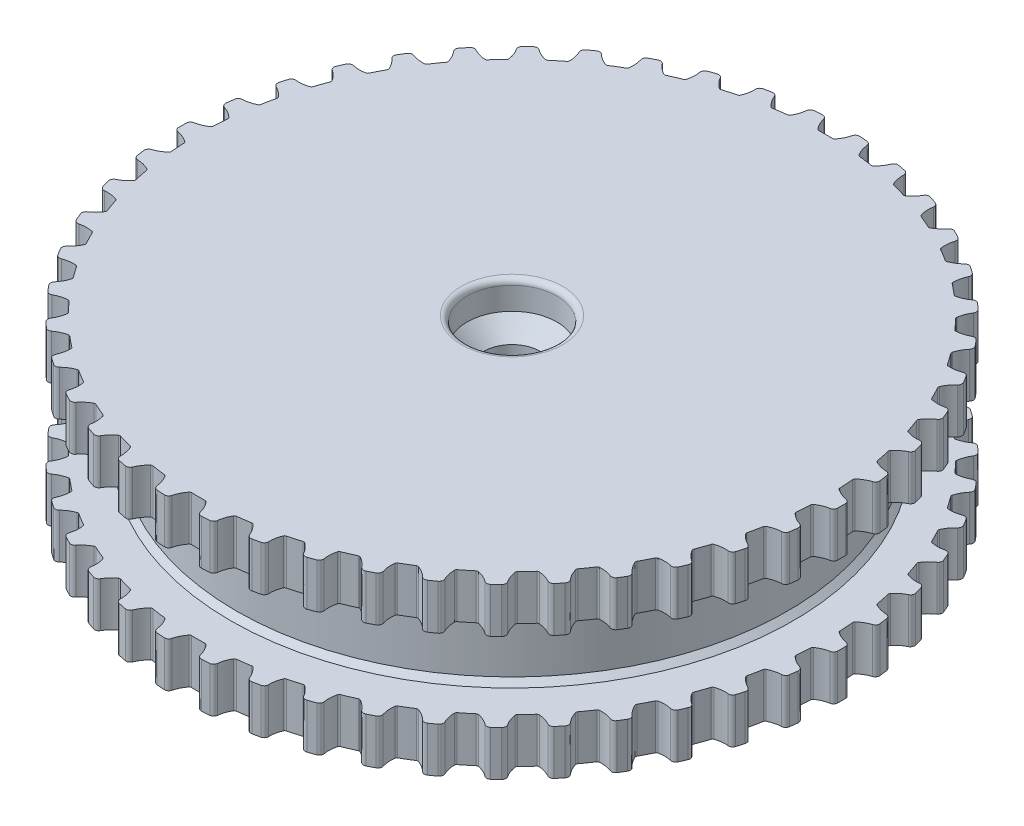
from build123d import *

# Parameters (mm, degrees)
SKETCH1_R           = 62.5
BOSS_EXTRUDE1_DEPTH = 2
BOSS_EXTRUDE2_DEPTH = 30
FILLET2_R           = 0.75
SKETCH3_R           = 62.5
BOSS_EXTRUDE3_DEPTH = 2
SKETCH4_R           = 5
CUT_EXTRUDE1_DEPTH  = 95.702164838
SKETCH5_R           = 8
CUT_EXTRUDE2_DEPTH  = 10
CUT_EXTRUDE3_START  = -10
SKETCH6_R           = 8
CUT_EXTRUDE3_DEPTH  = 10
FILLET3_R           = 0.75
CUT_EXTRUDE4_START  = -2
SKETCH7_R           = 62.5
CUT_EXTRUDE4_DEPTH  = 2
SKETCH9_R           = 62.5
CUT_EXTRUDE5_DEPTH  = 2
CHAMFER1_SIZE       = 3
SKETCH10_W          = 9.6
SKETCH10_H          = 14
CHAMFER2_SIZE       = 1
FILLET4_R           = 1


with BuildPart() as part:
    # Sketch1 → Boss-Extrude1 (new body)
    with BuildSketch(Plane(origin=(0, 0, 0), x_dir=(1, 0, 0), z_dir=(0, 1, 0))):
        with Locations(Location((0, 0, 0), (0, 0, 270))):
            Circle(SKETCH1_R)
    extrude(amount=BOSS_EXTRUDE1_DEPTH)

    # Sketch2 → Boss-Extrude2 (add)
    with BuildSketch(Plane(origin=(0, 2, 0), x_dir=(1, 0, 0), z_dir=(0, 1, 0))):
        with BuildLine():
            ThreePointArc((-1.528949245, 55.875032883), (-2.273279191, 57.114407356), (-2.655005911, 58.508810764))
            ThreePointArc((-2.655005911, 58.508810764), (-3.996891209, 58.432481156), (-5.336671662, 58.325379801))
            ThreePointArc((-5.336671662, 58.325379801), (-5.524971719, 56.891985494), (-6.093607466, 55.562801707))
            ThreePointArc((-6.093607466, 55.562801707), (-6.21983896, 55.432561322), (-6.390611604, 55.371457709))
            ThreePointArc((-6.390611604, 55.371457709), (-7.589795449, 55.219862826), (-8.785410114, 55.04230023))
            ThreePointArc((-8.785410114, 55.04230023), (-8.966335603, 55.055064048), (-9.123024525, 55.146417916))
            ThreePointArc((-9.123024525, 55.146417916), (-10.029183211, 56.272895874), (-10.597225747, 57.602333285))
            ThreePointArc((-10.597225747, 57.602333285), (-11.916219106, 57.343994591), (-13.228937139, 57.055457369))
            ThreePointArc((-13.228937139, 57.055457369), (-13.220302859, 55.609773585), (-13.6026518, 54.215540664))
            ThreePointArc((-13.6026518, 54.215540664), (-13.70997317, 54.069324826), (-13.870834955, 53.985536796))
            ThreePointArc((-13.870834955, 53.985536796), (-15.038207369, 53.672065031), (-16.198507911, 53.33335342))
            ThreePointArc((-16.198507911, 53.33335342), (-16.379486256, 53.321362337), (-16.54715512, 53.390529524))
            ThreePointArc((-16.54715512, 53.390529524), (-17.598262523, 54.383126814), (-18.342039318, 55.622833325))
            ThreePointArc((-18.342039318, 55.622833325), (-19.613570387, 55.187297905), (-20.874772547, 54.722699719))
            ThreePointArc((-20.874772547, 54.722699719), (-20.669364771, 53.291656813), (-20.858304469, 51.858346678))
            ThreePointArc((-20.858304469, 51.858346678), (-20.944716521, 51.698879111), (-21.092670895, 51.593967477))
            ThreePointArc((-21.092670895, 51.593967477), (-22.20648594, 51.124458215), (-23.309858154, 50.630907145))
            ThreePointArc((-23.309858154, 50.630907145), (-23.487518072, 50.594384533), (-23.663043523, 50.640076586))
            ThreePointArc((-23.663043523, 50.640076586), (-24.839519502, 51.480302998), (-25.745175401, 52.607185222))
            ThreePointArc((-25.745175401, 52.607185222), (-26.945557963, 52.002566278), (-28.131750439, 51.370561712))
            ThreePointArc((-28.131750439, 51.370561712), (-27.733395525, 49.980817306), (-27.72540639, 48.535129813))
            ThreePointArc((-27.72540639, 48.535129813), (-27.789299431, 48.365381096), (-27.921590285, 48.241300164))
            ThreePointArc((-27.921590285, 48.241300164), (-28.961099693, 47.624499473), (-29.986989844, 46.985302868))
            ThreePointArc((-29.986989844, 46.985302868), (-30.158021866, 46.924929074), (-30.338134197, 46.946294837))
            ThreePointArc((-30.338134197, 46.946294837), (-31.618063231, 47.618498542), (-32.668727578, 48.611564795))
            ThreePointArc((-32.668727578, 48.611564795), (-33.775600776, 47.849125233), (-34.864687048, 47.061487338))
            ThreePointArc((-34.864687048, 47.061487338), (-34.280805594, 45.738929739), (-34.076036449, 44.307795312))
            ThreePointArc((-34.076036449, 44.307795312), (-34.116220273, 44.130927542), (-34.230383277, 43.989988704))
            ThreePointArc((-34.230383277, 43.989988704), (-35.176222956, 43.237386416), (-36.105520651, 42.464451298))
            ThreePointArc((-36.105520651, 42.464451298), (-36.266738774, 42.381350971), (-36.448082834, 42.37799244))
            ThreePointArc((-36.448082834, 42.37799244), (-37.807622265, 42.869651556), (-38.983723172, 43.710402893))
            ThreePointArc((-38.983723172, 43.710402893), (-39.976468053, 42.80434552), (-40.948160504, 41.875746498))
            ThreePointArc((-40.948160504, 41.875746498), (-40.189629117, 40.645012453), (-39.791894423, 39.255090418))
            ThreePointArc((-39.791894423, 39.255090418), (-39.807620481, 39.074398307), (-39.901528996, 38.919226988))
            ThreePointArc((-39.901528996, 38.919226988), (-40.736079741, 38.044842658), (-41.551473922, 37.152567346))
            ThreePointArc((-41.551473922, 37.152567346), (-41.699874958, 37.048288489), (-41.879072649, 37.020268226))
            ThreePointArc((-41.879072649, 37.020268226), (-43.292896831, 37.322224074), (-44.572525763, 37.994998888))
            ThreePointArc((-44.572525763, 37.994998888), (-45.432649369, 36.962201838), (-46.268847206, 35.909939733))
            ThreePointArc((-46.268847206, 35.909939733), (-45.349795891, 34.793955489), (-44.766504693, 33.471137462))
            ThreePointArc((-44.766504693, 33.471137462), (-44.757480039, 33.289986963), (-44.829384726, 33.12347371))
            ThreePointArc((-44.829384726, 33.12347371), (-45.537100436, 32.143595465), (-46.223401853, 31.14860136))
            ThreePointArc((-46.223401853, 31.14860136), (-46.356221371, 31.02508649), (-46.529934579, 30.97292646))
            ThreePointArc((-46.529934579, 30.97292646), (-47.971706643, 31.079554174), (-49.331026534, 31.571819943))
            ThreePointArc((-49.331026534, 31.571819943), (-50.042506388, 30.431522272), (-50.727632829, 29.275198735))
            ThreePointArc((-50.727632829, 29.275198735), (-49.665181772, 28.294752966), (-48.907199682, 27.063680546))
            ThreePointArc((-48.907199682, 27.063680546), (-48.873592428, 26.88544615), (-48.922153839, 26.710692789))
            ThreePointArc((-48.922153839, 26.710692789), (-49.48985111, 25.643573906), (-50.034275265, 24.564395866))
            ThreePointArc((-50.034275265, 24.564395866), (-50.149039088, 24.423945831), (-50.314031867, 24.348617677))
            ThreePointArc((-50.314031867, 24.348617677), (-51.756894326, 24.257930984), (-53.170583618, 24.560517729))
            ThreePointArc((-53.170583618, 24.560517729), (-53.720166198, 23.333961024), (-54.241458633, 22.095116175))
            ThreePointArc((-54.241458633, 22.095116175), (-53.055399288, 21.268472731), (-52.136846077, 20.152078467))
            ThreePointArc((-52.136846077, 20.152078467), (-52.079282262, 19.980080343), (-52.10359579, 19.8003422))
            ThreePointArc((-52.10359579, 19.8003422), (-52.520699495, 18.665861085), (-52.913104797, 17.522602155))
            ThreePointArc((-52.913104797, 17.522602155), (-53.007675094, 17.367833273), (-53.160873938, 17.270740216))
            ThreePointArc((-53.160873938, 17.270740216), (-54.577948995, 16.984428438), (-56.019673332, 17.09169954))
            ThreePointArc((-56.019673332, 17.09169954), (-56.397120954, 15.801732232), (-56.744868691, 14.503443406))
            ThreePointArc((-56.744868691, 14.503443406), (-55.457295099, 13.846001091), (-54.395281677, 12.865081296))
            ThreePointArc((-54.395281677, 12.865081296), (-54.314833606, 12.702523444), (-54.314446336, 12.5211487))
            ThreePointArc((-54.314446336, 12.5211487), (-54.573186623, 11.340438589), (-54.806263302, 10.154395519))
            ThreePointArc((-54.806263302, 10.154395519), (-54.878878406, 9.988190843), (-55.017429512, 9.871141543))
            ThreePointArc((-55.017429512, 9.871141543), (-56.38231974, 9.394538126), (-57.825222525, 9.304495327))
            ThreePointArc((-57.825222525, 9.304495327), (-58.023504054, 7.975147066), (-58.191229211, 6.641598929))
            ThreePointArc((-58.191229211, 6.641598929), (-56.826126432, 6.165604648), (-55.640436098, 5.338432002))
            ThreePointArc((-55.640436098, 5.338432002), (-55.538602367, 5.188342567), (-55.513521513, 5.00870989))
            ThreePointArc((-55.513521513, 5.00870989), (-55.609078539, 3.803765179), (-55.67848482, 2.597031708))
            ThreePointArc((-55.67848482, 2.597031708), (-55.727792049, 2.422487316), (-55.849114471, 2.287662179))
            ThreePointArc((-55.849114471, 2.287662179), (-57.136394548, 1.629645343), (-58.553597232, 1.343965971))
            ThreePointArc((-58.553597232, 1.343965971), (-58.569019058, 0), (-58.553597232, -1.343965971))
            ThreePointArc((-58.553597232, -1.343965971), (-57.136394548, -1.629645343), (-55.849114471, -2.287662179))
            ThreePointArc((-55.849114471, -2.287662179), (-55.727792049, -2.422487316), (-55.67848482, -2.597031708))
            ThreePointArc((-55.67848482, -2.597031708), (-55.609078539, -3.803765179), (-55.513521513, -5.00870989))
            ThreePointArc((-55.513521513, -5.00870989), (-55.538602367, -5.188342567), (-55.640436098, -5.338432002))
            ThreePointArc((-55.640436098, -5.338432002), (-56.826126432, -6.165604648), (-58.191229211, -6.641598929))
            ThreePointArc((-58.191229211, -6.641598929), (-58.023504054, -7.975147066), (-57.825222525, -9.304495327))
            ThreePointArc((-57.825222525, -9.304495327), (-56.38231974, -9.394538126), (-55.017429512, -9.871141543))
            ThreePointArc((-55.017429512, -9.871141543), (-54.878878406, -9.988190843), (-54.806263302, -10.154395519))
            ThreePointArc((-54.806263302, -10.154395519), (-54.573186623, -11.340438589), (-54.314446336, -12.5211487))
            ThreePointArc((-54.314446336, -12.5211487), (-54.314833606, -12.702523444), (-54.395281677, -12.865081296))
            ThreePointArc((-54.395281677, -12.865081296), (-55.457295099, -13.846001091), (-56.744868691, -14.503443406))
            ThreePointArc((-56.744868691, -14.503443406), (-56.397120954, -15.801732232), (-56.019673332, -17.09169954))
            ThreePointArc((-56.019673332, -17.09169954), (-54.577948995, -16.984428438), (-53.160873938, -17.270740216))
            ThreePointArc((-53.160873938, -17.270740216), (-53.007675094, -17.367833273), (-52.913104797, -17.522602155))
            ThreePointArc((-52.913104797, -17.522602155), (-52.520699495, -18.665861085), (-52.10359579, -19.8003422))
            ThreePointArc((-52.10359579, -19.8003422), (-52.079282262, -19.980080343), (-52.136846077, -20.152078467))
            ThreePointArc((-52.136846077, -20.152078467), (-53.055399288, -21.268472731), (-54.241458633, -22.095116175))
            ThreePointArc((-54.241458633, -22.095116175), (-53.720166198, -23.333961024), (-53.170583618, -24.560517729))
            ThreePointArc((-53.170583618, -24.560517729), (-51.756894326, -24.257930984), (-50.314031867, -24.348617677))
            ThreePointArc((-50.314031867, -24.348617677), (-50.149039088, -24.423945831), (-50.034275265, -24.564395866))
            ThreePointArc((-50.034275265, -24.564395866), (-49.48985111, -25.643573906), (-48.922153839, -26.710692789))
            ThreePointArc((-48.922153839, -26.710692789), (-48.873592428, -26.88544615), (-48.907199682, -27.063680546))
            ThreePointArc((-48.907199682, -27.063680546), (-49.665181772, -28.294752966), (-50.727632829, -29.275198735))
            ThreePointArc((-50.727632829, -29.275198735), (-50.042506388, -30.431522272), (-49.331026534, -31.571819943))
            ThreePointArc((-49.331026534, -31.571819943), (-47.971706643, -31.079554174), (-46.529934579, -30.97292646))
            ThreePointArc((-46.529934579, -30.97292646), (-46.356221371, -31.02508649), (-46.223401853, -31.14860136))
            ThreePointArc((-46.223401853, -31.14860136), (-45.537100436, -32.143595465), (-44.829384726, -33.12347371))
            ThreePointArc((-44.829384726, -33.12347371), (-44.757480039, -33.289986963), (-44.766504693, -33.471137462))
            ThreePointArc((-44.766504693, -33.471137462), (-45.349795891, -34.793955489), (-46.268847206, -35.909939733))
            ThreePointArc((-46.268847206, -35.909939733), (-45.432649369, -36.962201838), (-44.572525763, -37.994998888))
            ThreePointArc((-44.572525763, -37.994998888), (-43.292896831, -37.322224074), (-41.879072649, -37.020268226))
            ThreePointArc((-41.879072649, -37.020268226), (-41.699874958, -37.048288489), (-41.551473922, -37.152567346))
            ThreePointArc((-41.551473922, -37.152567346), (-40.736079741, -38.044842658), (-39.901528996, -38.919226988))
            ThreePointArc((-39.901528996, -38.919226988), (-39.807620481, -39.074398307), (-39.791894423, -39.255090418))
            ThreePointArc((-39.791894423, -39.255090418), (-40.189629117, -40.645012453), (-40.948160504, -41.875746498))
            ThreePointArc((-40.948160504, -41.875746498), (-39.976468053, -42.80434552), (-38.983723172, -43.710402893))
            ThreePointArc((-38.983723172, -43.710402893), (-37.807622265, -42.869651556), (-36.448082834, -42.37799244))
            ThreePointArc((-36.448082834, -42.37799244), (-36.266738774, -42.381350971), (-36.105520651, -42.464451298))
            ThreePointArc((-36.105520651, -42.464451298), (-35.176222956, -43.237386416), (-34.230383277, -43.989988704))
            ThreePointArc((-34.230383277, -43.989988704), (-34.116220273, -44.130927542), (-34.076036449, -44.307795312))
            ThreePointArc((-34.076036449, -44.307795312), (-34.280805594, -45.738929739), (-34.864687048, -47.061487338))
            ThreePointArc((-34.864687048, -47.061487338), (-33.775600776, -47.849125233), (-32.668727578, -48.611564795))
            ThreePointArc((-32.668727578, -48.611564795), (-31.618063231, -47.618498542), (-30.338134197, -46.946294837))
            ThreePointArc((-30.338134197, -46.946294837), (-30.158021866, -46.924929074), (-29.986989844, -46.985302868))
            ThreePointArc((-29.986989844, -46.985302868), (-28.961099693, -47.624499473), (-27.921590285, -48.241300164))
            ThreePointArc((-27.921590285, -48.241300164), (-27.789299431, -48.365381096), (-27.72540639, -48.535129813))
            ThreePointArc((-27.72540639, -48.535129813), (-27.733395525, -49.980817306), (-28.131750439, -51.370561712))
            ThreePointArc((-28.131750439, -51.370561712), (-26.945557963, -52.002566278), (-25.745175401, -52.607185222))
            ThreePointArc((-25.745175401, -52.607185222), (-24.839519502, -51.480302998), (-23.663043523, -50.640076586))
            ThreePointArc((-23.663043523, -50.640076586), (-23.487518072, -50.594384533), (-23.309858154, -50.630907145))
            ThreePointArc((-23.309858154, -50.630907145), (-22.20648594, -51.124458215), (-21.092670895, -51.593967477))
            ThreePointArc((-21.092670895, -51.593967477), (-20.944716521, -51.698879111), (-20.858304469, -51.858346678))
            ThreePointArc((-20.858304469, -51.858346678), (-20.669364771, -53.291656813), (-20.874772547, -54.722699719))
            ThreePointArc((-20.874772547, -54.722699719), (-19.613570387, -55.187297905), (-18.342039318, -55.622833325))
            ThreePointArc((-18.342039318, -55.622833325), (-17.598262523, -54.383126814), (-16.54715512, -53.390529524))
            ThreePointArc((-16.54715512, -53.390529524), (-16.379486256, -53.321362337), (-16.198507911, -53.33335342))
            ThreePointArc((-16.198507911, -53.33335342), (-15.038207369, -53.672065031), (-13.870834955, -53.985536796))
            ThreePointArc((-13.870834955, -53.985536796), (-13.70997317, -54.069324826), (-13.6026518, -54.215540664))
            ThreePointArc((-13.6026518, -54.215540664), (-13.220302859, -55.609773585), (-13.228937139, -57.055457369))
            ThreePointArc((-13.228937139, -57.055457369), (-11.916219106, -57.343994591), (-10.597225747, -57.602333285))
            ThreePointArc((-10.597225747, -57.602333285), (-10.029183211, -56.272895874), (-9.123024525, -55.146417916))
            ThreePointArc((-9.123024525, -55.146417916), (-8.966335603, -55.055064048), (-8.785410114, -55.04230023))
            ThreePointArc((-8.785410114, -55.04230023), (-7.589795449, -55.219862826), (-6.390611604, -55.371457709))
            ThreePointArc((-6.390611604, -55.371457709), (-6.21983896, -55.432561322), (-6.093607466, -55.562801707))
            ThreePointArc((-6.093607466, -55.562801707), (-5.524971719, -56.891985494), (-5.336671662, -58.325379801))
            ThreePointArc((-5.336671662, -58.325379801), (-3.996891209, -58.432481156), (-2.655005911, -58.508810764))
            ThreePointArc((-2.655005911, -58.508810764), (-2.273279191, -57.114407356), (-1.528949245, -55.875032883))
            ThreePointArc((-1.528949245, -55.875032883), (-1.386159082, -55.763194084), (-1.208656749, -55.725913132))
            ThreePointArc((-1.208656749, -55.725913132), (0, -55.739019058), (1.208656749, -55.725913132))
            ThreePointArc((1.208656749, -55.725913132), (1.386159082, -55.763194084), (1.528949245, -55.875032883))
            ThreePointArc((1.528949245, -55.875032883), (2.273279191, -57.114407356), (2.655005911, -58.508810764))
            ThreePointArc((2.655005911, -58.508810764), (3.996891209, -58.432481156), (5.336671662, -58.325379801))
            ThreePointArc((5.336671662, -58.325379801), (5.524971719, -56.891985494), (6.093607466, -55.562801707))
            ThreePointArc((6.093607466, -55.562801707), (6.21983896, -55.432561322), (6.390611604, -55.371457709))
            ThreePointArc((6.390611604, -55.371457709), (7.589795449, -55.219862826), (8.785410114, -55.04230023))
            ThreePointArc((8.785410114, -55.04230023), (8.966335603, -55.055064048), (9.123024525, -55.146417916))
            ThreePointArc((9.123024525, -55.146417916), (10.029183211, -56.272895874), (10.597225747, -57.602333285))
            ThreePointArc((10.597225747, -57.602333285), (11.916219106, -57.343994591), (13.228937139, -57.055457369))
            ThreePointArc((13.228937139, -57.055457369), (13.220302859, -55.609773585), (13.6026518, -54.215540664))
            ThreePointArc((13.6026518, -54.215540664), (13.70997317, -54.069324826), (13.870834955, -53.985536796))
            ThreePointArc((13.870834955, -53.985536796), (15.038207369, -53.672065031), (16.198507911, -53.33335342))
            ThreePointArc((16.198507911, -53.33335342), (16.379486256, -53.321362337), (16.54715512, -53.390529524))
            ThreePointArc((16.54715512, -53.390529524), (17.598262523, -54.383126814), (18.342039318, -55.622833325))
            ThreePointArc((18.342039318, -55.622833325), (19.613570387, -55.187297905), (20.874772547, -54.722699719))
            ThreePointArc((20.874772547, -54.722699719), (20.669364771, -53.291656813), (20.858304469, -51.858346678))
            ThreePointArc((20.858304469, -51.858346678), (20.944716521, -51.698879111), (21.092670895, -51.593967477))
            ThreePointArc((21.092670895, -51.593967477), (22.20648594, -51.124458215), (23.309858154, -50.630907145))
            ThreePointArc((23.309858154, -50.630907145), (23.487518072, -50.594384533), (23.663043523, -50.640076586))
            ThreePointArc((23.663043523, -50.640076586), (24.839519502, -51.480302998), (25.745175401, -52.607185222))
            ThreePointArc((25.745175401, -52.607185222), (26.945557963, -52.002566278), (28.131750439, -51.370561712))
            ThreePointArc((28.131750439, -51.370561712), (27.733395525, -49.980817306), (27.72540639, -48.535129813))
            ThreePointArc((27.72540639, -48.535129813), (27.789299431, -48.365381096), (27.921590285, -48.241300164))
            ThreePointArc((27.921590285, -48.241300164), (28.961099693, -47.624499473), (29.986989844, -46.985302868))
            ThreePointArc((29.986989844, -46.985302868), (30.158021866, -46.924929074), (30.338134197, -46.946294837))
            ThreePointArc((30.338134197, -46.946294837), (31.618063231, -47.618498542), (32.668727578, -48.611564795))
            ThreePointArc((32.668727578, -48.611564795), (33.775600776, -47.849125233), (34.864687048, -47.061487338))
            ThreePointArc((34.864687048, -47.061487338), (34.280805594, -45.738929739), (34.076036449, -44.307795312))
            ThreePointArc((34.076036449, -44.307795312), (34.116220273, -44.130927542), (34.230383277, -43.989988704))
            ThreePointArc((34.230383277, -43.989988704), (35.176222956, -43.237386416), (36.105520651, -42.464451298))
            ThreePointArc((36.105520651, -42.464451298), (36.266738774, -42.381350971), (36.448082834, -42.37799244))
            ThreePointArc((36.448082834, -42.37799244), (37.807622265, -42.869651556), (38.983723172, -43.710402893))
            ThreePointArc((38.983723172, -43.710402893), (39.976468053, -42.80434552), (40.948160504, -41.875746498))
            ThreePointArc((40.948160504, -41.875746498), (40.189629117, -40.645012453), (39.791894423, -39.255090418))
            ThreePointArc((39.791894423, -39.255090418), (39.807620481, -39.074398307), (39.901528996, -38.919226988))
            ThreePointArc((39.901528996, -38.919226988), (40.736079741, -38.044842658), (41.551473922, -37.152567346))
            ThreePointArc((41.551473922, -37.152567346), (41.699874958, -37.048288489), (41.879072649, -37.020268226))
            ThreePointArc((41.879072649, -37.020268226), (43.292896831, -37.322224074), (44.572525763, -37.994998888))
            ThreePointArc((44.572525763, -37.994998888), (45.432649369, -36.962201838), (46.268847206, -35.909939733))
            ThreePointArc((46.268847206, -35.909939733), (45.349795891, -34.793955489), (44.766504693, -33.471137462))
            ThreePointArc((44.766504693, -33.471137462), (44.757480039, -33.289986963), (44.829384726, -33.12347371))
            ThreePointArc((44.829384726, -33.12347371), (45.537100436, -32.143595465), (46.223401853, -31.14860136))
            ThreePointArc((46.223401853, -31.14860136), (46.356221371, -31.02508649), (46.529934579, -30.97292646))
            ThreePointArc((46.529934579, -30.97292646), (47.971706643, -31.079554174), (49.331026534, -31.571819943))
            ThreePointArc((49.331026534, -31.571819943), (50.042506388, -30.431522272), (50.727632829, -29.275198735))
            ThreePointArc((50.727632829, -29.275198735), (49.665181772, -28.294752966), (48.907199682, -27.063680546))
            ThreePointArc((48.907199682, -27.063680546), (48.873592428, -26.88544615), (48.922153839, -26.710692789))
            ThreePointArc((48.922153839, -26.710692789), (49.48985111, -25.643573906), (50.034275265, -24.564395866))
            ThreePointArc((50.034275265, -24.564395866), (50.149039088, -24.423945831), (50.314031867, -24.348617677))
            ThreePointArc((50.314031867, -24.348617677), (51.756894326, -24.257930984), (53.170583618, -24.560517729))
            ThreePointArc((53.170583618, -24.560517729), (53.720166198, -23.333961024), (54.241458633, -22.095116175))
            ThreePointArc((54.241458633, -22.095116175), (53.055399288, -21.268472731), (52.136846077, -20.152078467))
            ThreePointArc((52.136846077, -20.152078467), (52.079282262, -19.980080343), (52.10359579, -19.8003422))
            ThreePointArc((52.10359579, -19.8003422), (52.520699495, -18.665861085), (52.913104797, -17.522602155))
            ThreePointArc((52.913104797, -17.522602155), (53.007675094, -17.367833273), (53.160873938, -17.270740216))
            ThreePointArc((53.160873938, -17.270740216), (54.577948995, -16.984428438), (56.019673332, -17.09169954))
            ThreePointArc((56.019673332, -17.09169954), (56.397120954, -15.801732232), (56.744868691, -14.503443406))
            ThreePointArc((56.744868691, -14.503443406), (55.457295099, -13.846001091), (54.395281677, -12.865081296))
            ThreePointArc((54.395281677, -12.865081296), (54.314833606, -12.702523444), (54.314446336, -12.5211487))
            ThreePointArc((54.314446336, -12.5211487), (54.573186623, -11.340438589), (54.806263302, -10.154395519))
            ThreePointArc((54.806263302, -10.154395519), (54.878878406, -9.988190843), (55.017429512, -9.871141543))
            ThreePointArc((55.017429512, -9.871141543), (56.38231974, -9.394538126), (57.825222525, -9.304495327))
            ThreePointArc((57.825222525, -9.304495327), (58.023504054, -7.975147066), (58.191229211, -6.641598929))
            ThreePointArc((58.191229211, -6.641598929), (56.826126432, -6.165604648), (55.640436098, -5.338432002))
            ThreePointArc((55.640436098, -5.338432002), (55.538602367, -5.188342567), (55.513521513, -5.00870989))
            ThreePointArc((55.513521513, -5.00870989), (55.609078539, -3.803765179), (55.67848482, -2.597031708))
            ThreePointArc((55.67848482, -2.597031708), (55.727792049, -2.422487316), (55.849114471, -2.287662179))
            ThreePointArc((55.849114471, -2.287662179), (57.136394548, -1.629645343), (58.553597232, -1.343965971))
            ThreePointArc((58.553597232, -1.343965971), (58.565163475, -0.672027225), (58.569019058, 0))
            ThreePointArc((58.569019058, 0), (58.565163475, 0.672027225), (58.553597232, 1.343965971))
            ThreePointArc((58.553597232, 1.343965971), (57.136394548, 1.629645343), (55.849114471, 2.287662179))
            ThreePointArc((55.849114471, 2.287662179), (55.727792049, 2.422487316), (55.67848482, 2.597031708))
            ThreePointArc((55.67848482, 2.597031708), (55.609078539, 3.803765179), (55.513521513, 5.00870989))
            ThreePointArc((55.513521513, 5.00870989), (55.538602367, 5.188342567), (55.640436098, 5.338432002))
            ThreePointArc((55.640436098, 5.338432002), (56.826126432, 6.165604648), (58.191229211, 6.641598929))
            ThreePointArc((58.191229211, 6.641598929), (58.023504054, 7.975147066), (57.825222525, 9.304495327))
            ThreePointArc((57.825222525, 9.304495327), (56.38231974, 9.394538126), (55.017429512, 9.871141543))
            ThreePointArc((55.017429512, 9.871141543), (54.878878406, 9.988190843), (54.806263302, 10.154395519))
            ThreePointArc((54.806263302, 10.154395519), (54.573186623, 11.340438589), (54.314446336, 12.5211487))
            ThreePointArc((54.314446336, 12.5211487), (54.314833606, 12.702523444), (54.395281677, 12.865081296))
            ThreePointArc((54.395281677, 12.865081296), (55.457295099, 13.846001091), (56.744868691, 14.503443406))
            ThreePointArc((56.744868691, 14.503443406), (56.397120954, 15.801732232), (56.019673332, 17.09169954))
            ThreePointArc((56.019673332, 17.09169954), (54.577948995, 16.984428438), (53.160873938, 17.270740216))
            ThreePointArc((53.160873938, 17.270740216), (53.007675094, 17.367833273), (52.913104797, 17.522602155))
            ThreePointArc((52.913104797, 17.522602155), (52.520699495, 18.665861085), (52.10359579, 19.8003422))
            ThreePointArc((52.10359579, 19.8003422), (52.079282262, 19.980080343), (52.136846077, 20.152078467))
            ThreePointArc((52.136846077, 20.152078467), (53.055399288, 21.268472731), (54.241458633, 22.095116175))
            ThreePointArc((54.241458633, 22.095116175), (53.720166198, 23.333961024), (53.170583618, 24.560517729))
            ThreePointArc((53.170583618, 24.560517729), (51.756894326, 24.257930984), (50.314031867, 24.348617677))
            ThreePointArc((50.314031867, 24.348617677), (50.149039088, 24.423945831), (50.034275265, 24.564395866))
            ThreePointArc((50.034275265, 24.564395866), (49.48985111, 25.643573906), (48.922153839, 26.710692789))
            ThreePointArc((48.922153839, 26.710692789), (48.873592428, 26.88544615), (48.907199682, 27.063680546))
            ThreePointArc((48.907199682, 27.063680546), (49.665181772, 28.294752966), (50.727632829, 29.275198735))
            ThreePointArc((50.727632829, 29.275198735), (50.042506388, 30.431522272), (49.331026534, 31.571819943))
            ThreePointArc((49.331026534, 31.571819943), (47.971706643, 31.079554174), (46.529934579, 30.97292646))
            ThreePointArc((46.529934579, 30.97292646), (46.356221371, 31.02508649), (46.223401853, 31.14860136))
            ThreePointArc((46.223401853, 31.14860136), (45.537100436, 32.143595465), (44.829384726, 33.12347371))
            ThreePointArc((44.829384726, 33.12347371), (44.757480039, 33.289986963), (44.766504693, 33.471137462))
            ThreePointArc((44.766504693, 33.471137462), (45.349795891, 34.793955489), (46.268847206, 35.909939733))
            ThreePointArc((46.268847206, 35.909939733), (45.432649369, 36.962201838), (44.572525763, 37.994998888))
            ThreePointArc((44.572525763, 37.994998888), (43.292896831, 37.322224074), (41.879072649, 37.020268226))
            ThreePointArc((41.879072649, 37.020268226), (41.699874958, 37.048288489), (41.551473922, 37.152567346))
            ThreePointArc((41.551473922, 37.152567346), (40.736079741, 38.044842658), (39.901528996, 38.919226988))
            ThreePointArc((39.901528996, 38.919226988), (39.807620481, 39.074398307), (39.791894423, 39.255090418))
            ThreePointArc((39.791894423, 39.255090418), (40.189629117, 40.645012453), (40.948160504, 41.875746498))
            ThreePointArc((40.948160504, 41.875746498), (39.976468053, 42.80434552), (38.983723172, 43.710402893))
            ThreePointArc((38.983723172, 43.710402893), (37.807622265, 42.869651556), (36.448082834, 42.37799244))
            ThreePointArc((36.448082834, 42.37799244), (36.266738774, 42.381350971), (36.105520651, 42.464451298))
            ThreePointArc((36.105520651, 42.464451298), (35.176222956, 43.237386416), (34.230383277, 43.989988704))
            ThreePointArc((34.230383277, 43.989988704), (34.116220273, 44.130927542), (34.076036449, 44.307795312))
            ThreePointArc((34.076036449, 44.307795312), (34.280805594, 45.738929739), (34.864687048, 47.061487338))
            ThreePointArc((34.864687048, 47.061487338), (33.775600776, 47.849125233), (32.668727578, 48.611564795))
            ThreePointArc((32.668727578, 48.611564795), (31.618063231, 47.618498542), (30.338134197, 46.946294837))
            ThreePointArc((30.338134197, 46.946294837), (30.158021866, 46.924929074), (29.986989844, 46.985302868))
            ThreePointArc((29.986989844, 46.985302868), (28.961099693, 47.624499473), (27.921590285, 48.241300164))
            ThreePointArc((27.921590285, 48.241300164), (27.789299431, 48.365381096), (27.72540639, 48.535129813))
            ThreePointArc((27.72540639, 48.535129813), (27.733395525, 49.980817306), (28.131750439, 51.370561712))
            ThreePointArc((28.131750439, 51.370561712), (26.945557963, 52.002566278), (25.745175401, 52.607185222))
            ThreePointArc((25.745175401, 52.607185222), (24.839519502, 51.480302998), (23.663043523, 50.640076586))
            ThreePointArc((23.663043523, 50.640076586), (23.487518072, 50.594384533), (23.309858154, 50.630907145))
            ThreePointArc((23.309858154, 50.630907145), (22.20648594, 51.124458215), (21.092670895, 51.593967477))
            ThreePointArc((21.092670895, 51.593967477), (20.944716521, 51.698879111), (20.858304469, 51.858346678))
            ThreePointArc((20.858304469, 51.858346678), (20.669364771, 53.291656813), (20.874772547, 54.722699719))
            ThreePointArc((20.874772547, 54.722699719), (19.613570387, 55.187297905), (18.342039318, 55.622833325))
            ThreePointArc((18.342039318, 55.622833325), (17.598262523, 54.383126814), (16.54715512, 53.390529524))
            ThreePointArc((16.54715512, 53.390529524), (16.379486256, 53.321362337), (16.198507911, 53.33335342))
            ThreePointArc((16.198507911, 53.33335342), (15.038207369, 53.672065031), (13.870834955, 53.985536796))
            ThreePointArc((13.870834955, 53.985536796), (13.70997317, 54.069324826), (13.6026518, 54.215540664))
            ThreePointArc((13.6026518, 54.215540664), (13.220302859, 55.609773585), (13.228937139, 57.055457369))
            ThreePointArc((13.228937139, 57.055457369), (11.916219106, 57.343994591), (10.597225747, 57.602333285))
            ThreePointArc((10.597225747, 57.602333285), (10.029183211, 56.272895874), (9.123024525, 55.146417916))
            ThreePointArc((9.123024525, 55.146417916), (8.966335603, 55.055064048), (8.785410114, 55.04230023))
            ThreePointArc((8.785410114, 55.04230023), (7.589795449, 55.219862826), (6.390611604, 55.371457709))
            ThreePointArc((6.390611604, 55.371457709), (6.21983896, 55.432561322), (6.093607466, 55.562801707))
            ThreePointArc((6.093607466, 55.562801707), (5.524971719, 56.891985494), (5.336671662, 58.325379801))
            ThreePointArc((5.336671662, 58.325379801), (3.996891209, 58.432481156), (2.655005911, 58.508810764))
            ThreePointArc((2.655005911, 58.508810764), (2.273279191, 57.114407356), (1.528949245, 55.875032883))
            ThreePointArc((1.528949245, 55.875032883), (1.386159082, 55.763194084), (1.208656749, 55.725913132))
            ThreePointArc((1.208656749, 55.725913132), (0, 55.739019058), (-1.208656749, 55.725913132))
            ThreePointArc((-1.208656749, 55.725913132), (-1.386159082, 55.763194084), (-1.528949245, 55.875032883))
        make_face()
    extrude(amount=BOSS_EXTRUDE2_DEPTH)

    # Fillet2
    fillet2_edges = [part.edges().sort_by_distance(p)[0] for p in [
        (-18.342039318, 17, -55.622833325),
        (-20.874772547, 17, -54.722699719),
        (-25.745175401, 17, -52.607185222),
        (-28.131750439, 17, -51.370561712),
        (-32.668727578, 17, -48.611564795),
        (-34.864687048, 17, -47.061487338),
        (-38.983723172, 17, -43.710402893),
        (-40.948160504, 17, -41.875746498),
        (-44.572525763, 17, -37.994998888),
        (-46.268847206, 17, -35.909939733),
        (-49.331026534, 17, -31.571819943),
        (-50.727632829, 17, -29.275198735),
        (-53.170583618, 17, -24.560517729),
        (-54.241458633, 17, -22.095116175),
        (-56.019673332, 17, -17.09169954),
        (-56.744868691, 17, -14.503443406),
        (-57.825222525, 17, -9.304495327),
        (-58.191229211, 17, -6.641598929),
        (-58.553597232, 17, -1.343965971),
        (-58.553597232, 17, 1.343965971),
        (-58.191229211, 17, 6.641598929),
        (-57.825222525, 17, 9.304495327),
        (-56.744868691, 17, 14.503443406),
        (-56.019673332, 17, 17.09169954),
        (-54.241458633, 17, 22.095116175),
        (-53.170583618, 17, 24.560517729),
        (-50.727632829, 17, 29.275198735),
        (-49.331026534, 17, 31.571819943),
        (-46.268847206, 17, 35.909939733),
        (-44.572525763, 17, 37.994998888),
        (-40.948160504, 17, 41.875746498),
        (-38.983723172, 17, 43.710402893),
        (-34.864687048, 17, 47.061487338),
        (-32.668727578, 17, 48.611564795),
        (-28.131750439, 17, 51.370561712),
        (-25.745175401, 17, 52.607185222),
        (-20.874772547, 17, 54.722699719),
        (-18.342039318, 17, 55.622833325),
        (-13.228937139, 17, 57.055457369),
        (-10.597225747, 17, 57.602333285),
        (-5.336671662, 17, 58.325379801),
        (-2.655005911, 17, 58.508810764),
        (2.655005911, 17, 58.508810764),
        (5.336671662, 17, 58.325379801),
        (10.597225747, 17, 57.602333285),
        (13.228937139, 17, 57.055457369),
        (18.342039318, 17, 55.622833325),
        (20.874772547, 17, 54.722699719),
        (25.745175401, 17, 52.607185222),
        (28.131750439, 17, 51.370561712),
        (32.668727578, 17, 48.611564795),
        (34.864687048, 17, 47.061487338),
        (38.983723172, 17, 43.710402893),
        (40.948160504, 17, 41.875746498),
        (44.572525763, 17, 37.994998888),
        (46.268847206, 17, 35.909939733),
        (49.331026534, 17, 31.571819943),
        (50.727632829, 17, 29.275198735),
        (53.170583618, 17, 24.560517729),
        (54.241458633, 17, 22.095116175),
        (56.019673332, 17, 17.09169954),
        (56.744868691, 17, 14.503443406),
        (57.825222525, 17, 9.304495327),
        (58.191229211, 17, 6.641598929),
        (58.553597232, 17, 1.343965971),
        (58.553597232, 17, -1.343965971),
        (58.191229211, 17, -6.641598929),
        (57.825222525, 17, -9.304495327),
        (56.744868691, 17, -14.503443406),
        (56.019673332, 17, -17.09169954),
        (54.241458633, 17, -22.095116175),
        (53.170583618, 17, -24.560517729),
        (50.727632829, 17, -29.275198735),
        (49.331026534, 17, -31.571819943),
        (46.268847206, 17, -35.909939733),
        (44.572525763, 17, -37.994998888),
        (40.948160504, 17, -41.875746498),
        (38.983723172, 17, -43.710402893),
        (34.864687048, 17, -47.061487338),
        (32.668727578, 17, -48.611564795),
        (28.131750439, 17, -51.370561712),
        (25.745175401, 17, -52.607185222),
        (20.874772547, 17, -54.722699719),
        (18.342039318, 17, -55.622833325),
        (13.228937139, 17, -57.055457369),
        (10.597225747, 17, -57.602333285),
        (5.336671662, 17, -58.325379801),
        (2.655005911, 17, -58.508810764),
        (-2.655005911, 17, -58.508810764),
        (-5.336671662, 17, -58.325379801),
        (-10.597225747, 17, -57.602333285),
        (-13.228937139, 17, -57.055457369),
    ]]
    fillet(fillet2_edges, radius=FILLET2_R)

    # Sketch3 → Boss-Extrude3 (add)
    with BuildSketch(Plane(origin=(0, 32, 0), x_dir=(1, 0, 0), z_dir=(0, 1, 0))):
        with Locations(Location((0, 0, 0), (0, 0, 270))):
            Circle(SKETCH3_R)
    extrude(amount=BOSS_EXTRUDE3_DEPTH)

    # Sketch4 → Cut-Extrude1 (cut, through all)
    with BuildSketch(Plane.XZ):
        with Locations(Location((0, 0, 0), (0, 0, 270))):
            Circle(SKETCH4_R)
    extrude(amount=-CUT_EXTRUDE1_DEPTH, mode=Mode.SUBTRACT)

    # Sketch5 → Cut-Extrude2 (cut)
    with BuildSketch(Plane(origin=(0, 34, 0), x_dir=(1, 0, 0), z_dir=(0, 1, 0))):
        with Locations(Location((0, 0, 0), (0, 0, 270))):
            Circle(SKETCH5_R)
    extrude(amount=-CUT_EXTRUDE2_DEPTH, mode=Mode.SUBTRACT)

    # Sketch6 → Cut-Extrude3 (cut)
    with BuildSketch(Plane.XZ.offset(CUT_EXTRUDE3_START)):
        with Locations(Location((0, 0, 0), (0, 0, 90))):
            Circle(SKETCH6_R)
    extrude(amount=CUT_EXTRUDE3_DEPTH, mode=Mode.SUBTRACT)

    # Fillet3
    fillet3_edges = [part.edges().sort_by_distance(p)[0] for p in [
        (0, 34, -8),
        (0, 0, -8),
    ]]
    fillet(fillet3_edges, radius=FILLET3_R)

    # Sketch7 → Cut-Extrude4 (cut)
    with BuildSketch(Plane(origin=(0, 34, 0), x_dir=(1, 0, 0), z_dir=(0, 1, 0)).offset(CUT_EXTRUDE4_START)):
        with Locations(Location((0, 0, 0), (0, 0, 270))):
            Circle(SKETCH7_R)
    extrude(amount=CUT_EXTRUDE4_DEPTH, mode=Mode.SUBTRACT)

    # Sketch9 → Cut-Extrude5 (cut)
    with BuildSketch(Plane.XZ):
        Circle(SKETCH9_R)
    extrude(amount=-CUT_EXTRUDE5_DEPTH, mode=Mode.SUBTRACT)

    # Chamfer1
    chamfer1_edges = [part.edges().sort_by_distance(p)[0] for p in [
        (0, 24, -8),
        (0, 10, -8),
    ]]
    chamfer(chamfer1_edges, length=CHAMFER1_SIZE - 0.0001)  # a hair under: the kernel refuses the full size

    # Sketch10 → Cut-Revolve1 (revolve, cut)
    with BuildSketch(Plane(origin=(0, 0, 0), x_dir=(0, 0, -1), z_dir=(1, 0, 0)), mode=Mode.PRIVATE) as cut_revolve1_sk:
        with Locations((-53.77, 17)):
            Rectangle(SKETCH10_W, SKETCH10_H)
    revolve(cut_revolve1_sk.sketch.rotate(Axis((0, 2, 0), (0, 1, 0)), 180), axis=Axis((0, 2, 0), (0, 1, 0)), mode=Mode.SUBTRACT)

    # Chamfer2
    chamfer2_edges = [part.edges().sort_by_distance(p)[0] for p in [
        (0, 10, 48.97),
        (0, 24, 48.97),
    ]]
    chamfer(chamfer2_edges, length=CHAMFER2_SIZE)

    # Fillet4
    fillet4_edges = [part.edges().sort_by_distance(p)[0] for p in [
        (0, 32, -8),
        (0, 2, -8),
    ]]
    fillet(fillet4_edges, radius=FILLET4_R)


solid = part.part
